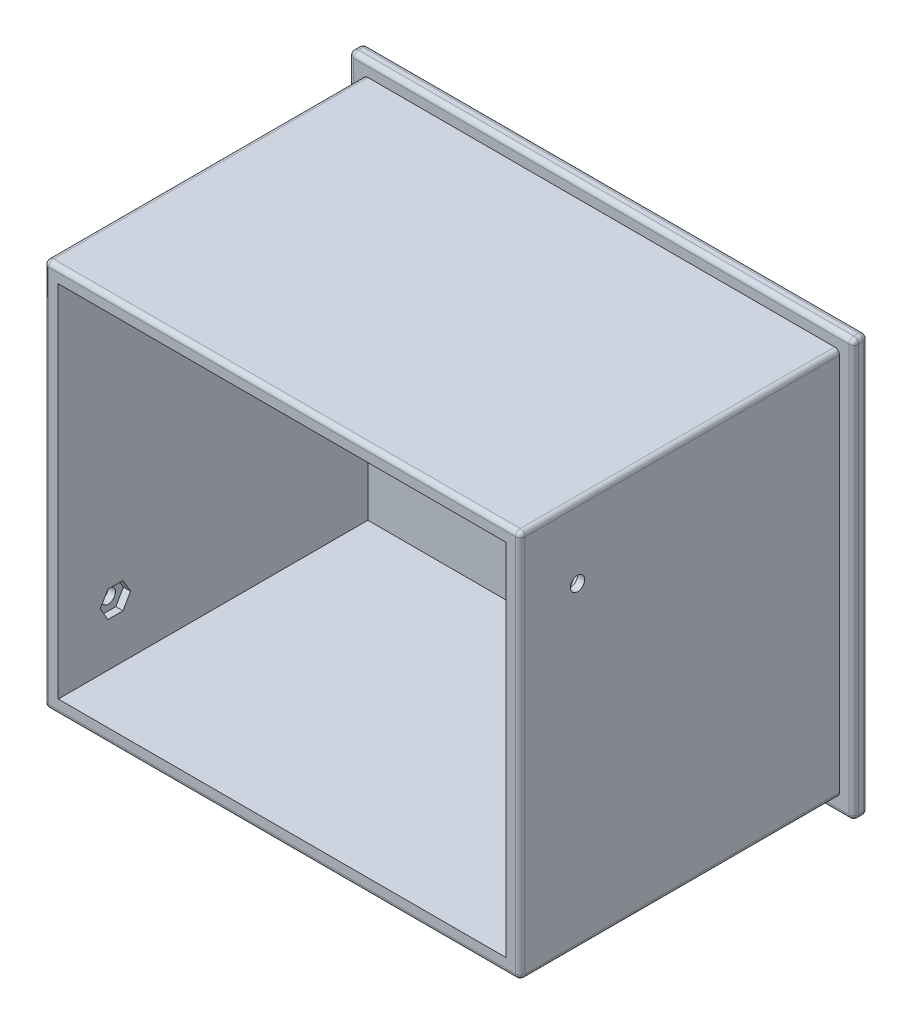
from build123d import *

# Parameters (mm, degrees)
ESQUISSE1_W             = 106
ESQUISSE1_H             = 87.5
ESQUISSE1_W_2           = 100
ESQUISSE1_H_2           = 81.5
BOSS_EXTRU_1_DEPTH      = 3
ESQUISSE1_32_W          = 100
ESQUISSE1_32_H          = 81.5
ESQUISSE1_32_W_2        = 94
ESQUISSE1_32_H_2        = 75.5
BOSS_EXTRU_2_DEPTH      = 70
ESQUISSE1_33_W          = 94
ESQUISSE1_33_H          = 75.5
BOSS_EXTRU_3_DEPTH      = 5
CONG_1_R                = 1
CONG_2_R                = 1
CONG_3_R                = 1
ESQUISSE13_R            = 1.5
ENL_V_MAT_EXTRU_1_DEPTH = 3
ESQUISSE13_3_R          = 1.5
ENL_V_MAT_EXTRU_2_DEPTH = 3
ESQUISSE13_4_R          = 1.5
BOSS_EXTRU_6_DEPTH      = 1.5
ESQUISSE11_R            = 1.5
ENL_V_MAT_EXTRU_6_DEPTH = 3
ESQUISSE11_11_R         = 5
ESQUISSE11_11_R_2       = 1.5
BOSS_EXTRU_8_DEPTH      = 1.5
ESQUISSE11_12_R         = 1.5
ENL_V_MAT_EXTRU_7_DEPTH = 1.5
CONG_5_R                = 1


with BuildPart() as part:
    # Esquisse1 → Boss.-Extru.1 (new body)
    with BuildSketch(Plane.XY):
        with Locations((-55.377032771, -30.405018472)):
            Rectangle(ESQUISSE1_W, ESQUISSE1_H)
        with Locations((-55.377032771, -30.405018472)):
            Rectangle(ESQUISSE1_W_2, ESQUISSE1_H_2, mode=Mode.SUBTRACT)
    extrude(amount=BOSS_EXTRU_1_DEPTH)

    # Esquisse1<32> → Boss.-Extru.2 (add)
    with BuildSketch(Plane.XY):
        with Locations((-55.377032771, -30.405018472)):
            Rectangle(ESQUISSE1_32_W, ESQUISSE1_32_H)
        with Locations((-55.377032771, -30.405018472)):
            Rectangle(ESQUISSE1_32_W_2, ESQUISSE1_32_H_2, mode=Mode.SUBTRACT)
    extrude(amount=BOSS_EXTRU_2_DEPTH)

    # Esquisse1<33> → Boss.-Extru.3 (add)
    with BuildSketch(Plane.XY):
        with Locations((-55.377032771, -30.405018472)):
            Rectangle(ESQUISSE1_33_W, ESQUISSE1_33_H)
    extrude(amount=BOSS_EXTRU_3_DEPTH)

    # Congé1
    cong_1_edges = [part.edges().sort_by_distance(p)[0] for p in [
        (-55.377032771, 10.344981528, 70),
        (-105.377032771, -30.405018472, 70),
        (-55.377032771, -71.155018472, 70),
        (-5.377032771, -30.405018472, 70),
    ]]
    fillet(cong_1_edges, radius=CONG_1_R)

    # Congé2
    cong_2_edges = [part.edges().sort_by_distance(p)[0] for p in [
        (-55.377032771, -74.155018472, 3),
        (-2.377032771, -30.405018472, 3),
        (-55.377032771, 13.344981528, 3),
        (-108.377032771, -30.405018472, 3),
    ]]
    fillet(cong_2_edges, radius=CONG_2_R)

    # Congé3
    # the kernel refuses this fillet: 1 mm, written as the material it takes off along each edge
    with BuildSketch(Plane(origin=(-107.377032771, -73.155018472, 2), x_dir=(-1, 0, 0), z_dir=(0, -1, 0))) as cong_3_piece_1_section:
        Polygon((0, 0), (CONG_3_R, 0), (CONG_3_R, -CONG_3_R), (0, -CONG_3_R), align=None)
    cong_3_piece_1 = extrude(amount=CONG_3_R, mode=Mode.PRIVATE)
    cong_3_piece_1 = cong_3_piece_1 - Plane(origin=(-107.377032771, -73.155018472, 2), x_dir=(0.7071067811865475, 0, -0.7071067811865475), z_dir=(0, -1, 0)) * Sphere(CONG_3_R, mode=Mode.PRIVATE)
    add(cong_3_piece_1, mode=Mode.SUBTRACT)
    with BuildSketch(Plane(origin=(-107.377032771, 12.344981528, 2), x_dir=(0, 1, 0), z_dir=(-1, 0, 0))) as cong_3_piece_2_section:
        Polygon((0, 0), (CONG_3_R, 0), (CONG_3_R, -CONG_3_R), (0, -CONG_3_R), align=None)
    cong_3_piece_2 = extrude(amount=CONG_3_R, mode=Mode.PRIVATE)
    cong_3_piece_2 = cong_3_piece_2 - Plane(origin=(-107.377032771, 12.344981528, 2), x_dir=(0, -0.7071067811865475, -0.7071067811865475), z_dir=(-1, 0, 0)) * Sphere(CONG_3_R, mode=Mode.PRIVATE)
    add(cong_3_piece_2, mode=Mode.SUBTRACT)
    with BuildSketch(Plane(origin=(-3.377032771, -73.155018472, 2), x_dir=(1, 0, 0), z_dir=(0, -1, 0))) as cong_3_piece_3_section:
        Polygon((0, 0), (CONG_3_R, 0), (CONG_3_R, CONG_3_R), (0, CONG_3_R), align=None)
    cong_3_piece_3 = extrude(amount=CONG_3_R, mode=Mode.PRIVATE)
    cong_3_piece_3 = cong_3_piece_3 - Plane(origin=(-3.377032771, -73.155018472, 2), x_dir=(-0.7071067811865475, 0, -0.7071067811865475), z_dir=(0, -1, 0)) * Sphere(CONG_3_R, mode=Mode.PRIVATE)
    add(cong_3_piece_3, mode=Mode.SUBTRACT)
    with BuildSketch(Plane(origin=(-3.377032771, 12.344981528, 2), x_dir=(0, 1, 0), z_dir=(1, 0, 0))) as cong_3_piece_4_section:
        Polygon((0, 0), (CONG_3_R, 0), (CONG_3_R, CONG_3_R), (0, CONG_3_R), align=None)
    cong_3_piece_4 = extrude(amount=CONG_3_R, mode=Mode.PRIVATE)
    cong_3_piece_4 = cong_3_piece_4 - Plane(origin=(-3.377032771, 12.344981528, 2), x_dir=(0, -0.7071067811865475, -0.7071067811865475), z_dir=(1, 0, 0)) * Sphere(CONG_3_R, mode=Mode.PRIVATE)
    add(cong_3_piece_4, mode=Mode.SUBTRACT)
    with BuildSketch(Plane(origin=(-3.377032771, -73.155018472, 1), x_dir=(1, 0, 0), z_dir=(0, 0, -1))) as cong_3_piece_5_section:
        Polygon((0, 0), (CONG_3_R, 0), (CONG_3_R, CONG_3_R), (0, CONG_3_R), align=None)
    cong_3_piece_5 = extrude(amount=CONG_3_R, mode=Mode.PRIVATE)
    cong_3_piece_5 = cong_3_piece_5 - Plane(origin=(-3.377032771, -73.155018472, 1), x_dir=(-0.7071067811865475, 0.7071067811865475, 0), z_dir=(0, 0, -1)) * Sphere(CONG_3_R, mode=Mode.PRIVATE)
    add(cong_3_piece_5, mode=Mode.SUBTRACT)
    with BuildSketch(Plane(origin=(-3.377032771, 12.344981528, 1), x_dir=(1, 0, 0), z_dir=(0, 0, -1))) as cong_3_piece_6_section:
        Polygon((0, 0), (CONG_3_R, 0), (CONG_3_R, -CONG_3_R), (0, -CONG_3_R), align=None)
    cong_3_piece_6 = extrude(amount=CONG_3_R, mode=Mode.PRIVATE)
    cong_3_piece_6 = cong_3_piece_6 - Plane(origin=(-3.377032771, 12.344981528, 1), x_dir=(-0.7071067811865475, -0.7071067811865475, 0), z_dir=(0, 0, -1)) * Sphere(CONG_3_R, mode=Mode.PRIVATE)
    add(cong_3_piece_6, mode=Mode.SUBTRACT)
    with BuildSketch(Plane(origin=(-107.377032771, -73.155018472, 1), x_dir=(-1, 0, 0), z_dir=(0, -1, 0))) as cong_3_piece_7_section:
        Polygon((0, 0), (CONG_3_R, 0), (CONG_3_R, CONG_3_R), (0, CONG_3_R), align=None)
    cong_3_piece_7 = extrude(amount=CONG_3_R, mode=Mode.PRIVATE)
    cong_3_piece_7 = cong_3_piece_7 - Plane(origin=(-107.377032771, -73.155018472, 1), x_dir=(0.7071067811865475, 0, 0.7071067811865475), z_dir=(0, -1, 0)) * Sphere(CONG_3_R, mode=Mode.PRIVATE)
    add(cong_3_piece_7, mode=Mode.SUBTRACT)
    with BuildSketch(Plane(origin=(-107.377032771, 12.344981528, 1), x_dir=(-1, 0, 0), z_dir=(0, 0, -1))) as cong_3_piece_8_section:
        Polygon((0, 0), (CONG_3_R, 0), (CONG_3_R, CONG_3_R), (0, CONG_3_R), align=None)
    cong_3_piece_8 = extrude(amount=CONG_3_R, mode=Mode.PRIVATE)
    cong_3_piece_8 = cong_3_piece_8 - Plane(origin=(-107.377032771, 12.344981528, 1), x_dir=(0.7071067811865475, -0.7071067811865475, 0), z_dir=(0, 0, -1)) * Sphere(CONG_3_R, mode=Mode.PRIVATE)
    add(cong_3_piece_8, mode=Mode.SUBTRACT)
    with BuildSketch(Plane(origin=(-2.377032771, -73.155018472, 0), x_dir=(0, 0, 1), z_dir=(0, 1, 0)), Plane(origin=(-108.377032771, 12.344981528, 0), x_dir=(0, 0, 1), z_dir=(0, -1, 0))) as cong_3_piece_9:
        with BuildLine():
            CenterArc((CONG_3_R, -CONG_3_R), CONG_3_R, 90, 90)
            Line((0, -CONG_3_R), (0, 0))
            Line((0, 0), (CONG_3_R, 0))
        make_face()
    extrude(amount=85.5, mode=Mode.SUBTRACT)
    with BuildSketch(Plane(origin=(-107.377032771, -74.155018472, 0), x_dir=(0, 0, 1), z_dir=(1, 0, 0)), Plane(origin=(-3.377032771, 13.344981528, 0), x_dir=(0, 0, 1), z_dir=(-1, 0, 0))) as cong_3_piece_10:
        with BuildLine():
            CenterArc((CONG_3_R, -CONG_3_R), CONG_3_R, 90, 90)
            Line((0, -CONG_3_R), (0, 0))
            Line((0, 0), (CONG_3_R, 0))
        make_face()
    extrude(amount=104, mode=Mode.SUBTRACT)
    with BuildSketch(Plane(origin=(-2.377032771, 13.344981528, 1), x_dir=(0, -1, 0), z_dir=(0, 0, 1)), Plane(origin=(-2.377032771, -74.155018472, 1), x_dir=(-1, 0, 0), z_dir=(0, 0, 1))) as cong_3_piece_11:
        with BuildLine():
            CenterArc((CONG_3_R, -CONG_3_R), CONG_3_R, 90, 90)
            Line((0, -CONG_3_R), (0, 0))
            Line((0, 0), (CONG_3_R, 0))
        make_face()
    extrude(amount=1, mode=Mode.SUBTRACT)
    with BuildSketch(Plane(origin=(-108.377032771, 13.344981528, 1), x_dir=(0, -1, 0), z_dir=(0, 0, 1)), Plane(origin=(-108.377032771, -74.155018472, 1), x_dir=(1, 0, 0), z_dir=(0, 0, 1))) as cong_3_piece_12:
        with BuildLine():
            CenterArc((CONG_3_R, CONG_3_R), CONG_3_R, 180, 90)
            Line((0, CONG_3_R), (0, 0))
            Line((0, 0), (CONG_3_R, 0))
        make_face()
    extrude(amount=1, mode=Mode.SUBTRACT)

    # Esquisse13 → Enlèv. mat.-Extru.1 (cut)
    with BuildSketch(Plane.ZY.offset(105.377032771)):
        with Locations((58, -56.155018472)):
            Circle(ESQUISSE13_R)
    extrude(amount=-ENL_V_MAT_EXTRU_1_DEPTH, mode=Mode.SUBTRACT)

    # Esquisse13<3> → Enlèv. mat.-Extru.2 (cut)
    with BuildSketch(Plane.ZY.offset(105.377032771)):
        Polygon((56.41228676, -58.905018472), (59.58771324, -58.905018472), (61.175426481, -56.155018472), (59.58771324, -53.405018472), (56.41228676, -53.405018472), (54.824573519, -56.155018472), align=None)
        with Locations((58, -56.155018472)):
            Circle(ESQUISSE13_3_R, mode=Mode.SUBTRACT)
    extrude(amount=-ENL_V_MAT_EXTRU_2_DEPTH, mode=Mode.SUBTRACT)

    # Esquisse13<4> → Boss.-Extru.6 (add)
    with BuildSketch(Plane.ZY.offset(105.377032771)):
        Polygon((56.41228676, -58.905018472), (59.58771324, -58.905018472), (61.175426481, -56.155018472), (59.58771324, -53.405018472), (56.41228676, -53.405018472), (54.824573519, -56.155018472), align=None)
        with Locations((58, -56.155018472)):
            Circle(ESQUISSE13_4_R, mode=Mode.SUBTRACT)
    extrude(amount=-BOSS_EXTRU_6_DEPTH)

    # Esquisse11 → Enlèv. mat.-Extru.6 (cut)
    # profile 1 of 2: a face of its own
    with BuildSketch(Plane(origin=(-5.377032771, 0, 0), x_dir=(0, 0, -1), z_dir=(1, 0, 0))):
        Polygon((-59.58771324, -7.405018472), (-56.41228676, -7.405018472), (-54.824573519, -4.655018472), (-56.41228676, -1.905018472), (-59.58771324, -1.905018472), (-61.175426481, -4.655018472), align=None)
        with Locations((-58, -4.655018472)):
            Circle(ESQUISSE11_R, mode=Mode.SUBTRACT)
    # profile 2 of 2: a face of its own
    with BuildSketch(Plane(origin=(-5.377032771, 0, 0), x_dir=(0, 0, -1), z_dir=(1, 0, 0))):
        with Locations((-58, -4.655018472)):
            Circle(ESQUISSE11_R)
    extrude(amount=-ENL_V_MAT_EXTRU_6_DEPTH, mode=Mode.SUBTRACT)

    # Esquisse11<11> → Boss.-Extru.8 (add)
    # profile 1 of 3: a face of its own
    with BuildSketch(Plane(origin=(-5.377032771, 0, 0), x_dir=(0, 0, -1), z_dir=(1, 0, 0))):
        with Locations((-58, -4.655018472)):
            Circle(ESQUISSE11_11_R)
        Polygon((-56.41228676, -7.405018472), (-54.824573519, -4.655018472), (-56.41228676, -1.905018472), (-59.58771324, -1.905018472), (-61.175426481, -4.655018472), (-59.58771324, -7.405018472), align=None, mode=Mode.SUBTRACT)
    # profile 2 of 3: a face of its own
    with BuildSketch(Plane(origin=(-5.377032771, 0, 0), x_dir=(0, 0, -1), z_dir=(1, 0, 0))):
        Polygon((-59.58771324, -7.405018472), (-56.41228676, -7.405018472), (-54.824573519, -4.655018472), (-56.41228676, -1.905018472), (-59.58771324, -1.905018472), (-61.175426481, -4.655018472), align=None)
        with Locations((-58, -4.655018472)):
            Circle(ESQUISSE11_11_R_2, mode=Mode.SUBTRACT)
    # profile 3 of 3: a face of its own
    with BuildSketch(Plane(origin=(-5.377032771, 0, 0), x_dir=(0, 0, -1), z_dir=(1, 0, 0))):
        with Locations((-58, -4.655018472)):
            Circle(ESQUISSE11_11_R_2)
    extrude(amount=-BOSS_EXTRU_8_DEPTH)

    # Esquisse11<12> → Enlèv. mat.-Extru.7 (cut)
    with BuildSketch(Plane(origin=(-5.377032771, 0, 0), x_dir=(0, 0, -1), z_dir=(1, 0, 0))):
        with Locations((-58, -4.655018472)):
            Circle(ESQUISSE11_12_R)
    extrude(amount=-ENL_V_MAT_EXTRU_7_DEPTH, mode=Mode.SUBTRACT)

    # Congé5
    # the kernel refuses this fillet: 1 mm, written as the material it takes off along each edge
    with BuildSketch(Plane(origin=(-104.377032771, 9.344981528, 69), x_dir=(0, 1, 0), z_dir=(-1, 0, 0))) as cong_5_piece_1_section:
        Polygon((0, 0), (CONG_5_R, 0), (CONG_5_R, -CONG_5_R), (0, -CONG_5_R), align=None)
    cong_5_piece_1 = extrude(amount=CONG_5_R, mode=Mode.PRIVATE)
    cong_5_piece_1 = cong_5_piece_1 - Plane(origin=(-104.377032771, 9.344981528, 69), x_dir=(0, -0.7071067811865475, -0.7071067811865475), z_dir=(-1, 0, 0)) * Sphere(CONG_5_R, mode=Mode.PRIVATE)
    with BuildSketch(Plane(origin=(-6.377032771, 9.344981528, 69), x_dir=(1, 0, 0), z_dir=(0, 1, 0))) as cong_5_piece_2_section:
        Polygon((0, 0), (CONG_5_R, 0), (CONG_5_R, -CONG_5_R), (0, -CONG_5_R), align=None)
    cong_5_piece_2 = extrude(amount=CONG_5_R, mode=Mode.PRIVATE)
    cong_5_piece_2 = cong_5_piece_2 - Plane(origin=(-6.377032771, 9.344981528, 69), x_dir=(-0.7071067811865475, 0, -0.7071067811865475), z_dir=(0, 1, 0)) * Sphere(CONG_5_R, mode=Mode.PRIVATE)
    with BuildSketch(Plane(origin=(-104.377032771, -70.155018472, 69), x_dir=(-1, 0, 0), z_dir=(0, -1, 0))) as cong_5_piece_3_section:
        Polygon((0, 0), (CONG_5_R, 0), (CONG_5_R, -CONG_5_R), (0, -CONG_5_R), align=None)
    cong_5_piece_3 = extrude(amount=CONG_5_R, mode=Mode.PRIVATE)
    cong_5_piece_3 = cong_5_piece_3 - Plane(origin=(-104.377032771, -70.155018472, 69), x_dir=(0.7071067811865475, 0, -0.7071067811865475), z_dir=(0, -1, 0)) * Sphere(CONG_5_R, mode=Mode.PRIVATE)
    with BuildSketch(Plane(origin=(-6.377032771, -70.155018472, 69), x_dir=(1, 0, 0), z_dir=(0, -1, 0))) as cong_5_piece_4_section:
        Polygon((0, 0), (CONG_5_R, 0), (CONG_5_R, CONG_5_R), (0, CONG_5_R), align=None)
    cong_5_piece_4 = extrude(amount=CONG_5_R, mode=Mode.PRIVATE)
    cong_5_piece_4 = cong_5_piece_4 - Plane(origin=(-6.377032771, -70.155018472, 69), x_dir=(-0.7071067811865475, 0, -0.7071067811865475), z_dir=(0, -1, 0)) * Sphere(CONG_5_R, mode=Mode.PRIVATE)
    with BuildSketch(Plane(origin=(-5.377032771, -71.155018472, 3), x_dir=(-1, 0, 0), z_dir=(0, 0, 1))) as cong_5_piece_5:
        with BuildLine():
            CenterArc((CONG_5_R, -CONG_5_R), CONG_5_R, 90, 90)
            Line((0, -CONG_5_R), (0, 0))
            Line((0, 0), (CONG_5_R, 0))
        make_face()
    cong_5_piece_5_solid = extrude(amount=66, mode=Mode.PRIVATE)
    with BuildSketch(Plane(origin=(-105.377032771, -71.155018472, 3), x_dir=(1, 0, 0), z_dir=(0, 0, 1)), Plane(origin=(-5.377032771, 10.344981528, 3), x_dir=(-1, 0, 0), z_dir=(0, 0, 1)), Plane(origin=(-105.377032771, 10.344981528, 3), x_dir=(0, -1, 0), z_dir=(0, 0, 1))) as cong_5_piece_6:
        with BuildLine():
            CenterArc((CONG_5_R, CONG_5_R), CONG_5_R, 180, 90)
            Line((0, CONG_5_R), (0, 0))
            Line((0, 0), (CONG_5_R, 0))
        make_face()
    cong_5_piece_6_solid = extrude(amount=66, mode=Mode.PRIVATE)
    add([cong_5_piece_1, cong_5_piece_2, cong_5_piece_3, cong_5_piece_4, cong_5_piece_5_solid, cong_5_piece_6_solid], mode=Mode.SUBTRACT)


solid = part.part
